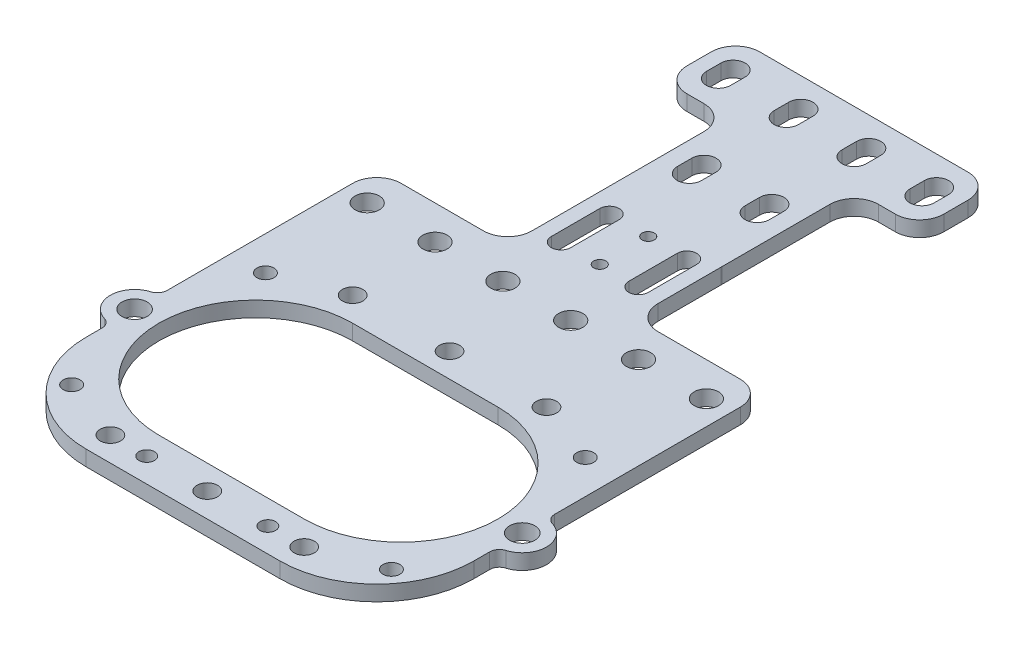
from build123d import *

# Parameters (mm, degrees)
BASE_FLANGE1_DEPTH         = 3.175
CUT_EXTRUDE1_DEPTH         = 3.175
CUT_EXTRUDE2_DEPTH         = 3.175
CUT_EXTRUDE3_DEPTH         = 291.545849439
CUT_EXTRUDE4_DEPTH         = 291.545849439
CUT_EXTRUDE5_DEPTH         = 291.545849439
CUT_EXTRUDE6_DEPTH         = 291.545849439
CUT_EXTRUDE7_DEPTH         = 291.545849439
CUT_EXTRUDE8_DEPTH         = 291.545849439
CUT_EXTRUDE9_DEPTH         = 291.545849439
CUT_EXTRUDE10_DEPTH        = 291.545849439
CUT_EXTRUDE11_DEPTH        = 291.545849439
F_4_2_4_2_DIAMETER_HOLE1_D = 4.2
F_5_2_5_2_DIAMETER_HOLE1_D = 5.2
F_3_5_3_5_DIAMETER_HOLE1_D = 3.5
F_3_2_3_2_DIAMETER_HOLE1_D = 3.2
F_5_0_5_DIAMETER_HOLE1_D   = 5
F_2_5_2_5_DIAMETER_HOLE1_D = 2.5


# Sheet-metal steps are written as plain solids
with BuildPart() as part:
    # Sketch11 → Base-Flange1 (new body)
    with BuildSketch(Plane(origin=(0, 32.675, 0), x_dir=(1, 0, 0), z_dir=(0, 1, 0))):
        with BuildLine():
            Line((222.001, 57.5), (222.001, 22))
            ThreePointArc((222.001, 22), (220.536533906, 18.464466094), (217.001, 17))
            Line((217.001, 17), (200.001, 17))
            ThreePointArc((200.001, 17), (196.465466094, 15.535533906), (195.001, 12))
            Line((195.001, 12), (195.001, -26.291796068))
            ThreePointArc((195.001, -26.291796068), (194.604567451, -27.487024677), (193.572428571, -28.208425763))
            ThreePointArc((193.572428571, -28.208425763), (190.001, -33), (193.572428571, -37.791574237))
            ThreePointArc((193.572428571, -37.791574237), (194.604567451, -38.512975323), (195.001, -39.708203932))
            Line((195.001, -39.708203932), (195.001, -43))
            ThreePointArc((195.001, -43), (200.858864376, -57.142135624), (215.001, -63))
            Line((215.001, -63), (255.001, -63))
            ThreePointArc((255.001, -63), (269.143135624, -57.142135624), (275.001, -43))
            Line((275.001, -43), (275.001, -39.708203932))
            ThreePointArc((275.001, -39.708203932), (275.397432549, -38.512975323), (276.429571429, -37.791574237))
            ThreePointArc((276.429571429, -37.791574237), (280.001, -33), (276.429571429, -28.208425763))
            ThreePointArc((276.429571429, -28.208425763), (275.397432549, -27.487024677), (275.001, -26.291796068))
            Line((275.001, -26.291796068), (275.001, 12))
            ThreePointArc((275.001, 12), (273.536533906, 15.535533906), (270.001, 17))
            Line((270.001, 17), (253.001, 17))
            ThreePointArc((253.001, 17), (249.465466094, 18.464466094), (248.001, 22))
            Line((248.001, 22), (248.001, 57.5))
            ThreePointArc((248.001, 57.5), (249.465466094, 61.035533906), (253.001, 62.5))
            Line((253.001, 62.5), (256.501, 62.5))
            ThreePointArc((256.501, 62.5), (260.036533906, 63.964466094), (261.501, 67.5))
            Line((261.501, 67.5), (261.501, 72.5))
            ThreePointArc((261.501, 72.5), (260.036533906, 76.035533906), (256.501, 77.5))
            Line((256.501, 77.5), (213.501, 77.5))
            ThreePointArc((213.501, 77.5), (209.965466094, 76.035533906), (208.501, 72.5))
            Line((208.501, 72.5), (208.501, 67.5))
            ThreePointArc((208.501, 67.5), (209.965466094, 63.964466094), (213.501, 62.5))
            Line((213.501, 62.5), (217.001, 62.5))
            ThreePointArc((217.001, 62.5), (220.536533906, 61.035533906), (222.001, 57.5))
        make_face()
    extrude(amount=-BASE_FLANGE1_DEPTH)

    # Sketch16 → Cut-Extrude1 (cut)
    with BuildSketch(Plane.XZ.offset(-29.5)):
        with BuildLine():
            Line((222.001, -35), (222.001, -35.230121613))
            Line((222.001, -35.230121613), (222.006298403, -35.230121613))
            ThreePointArc((222.006298403, -35.230121613), (222.002324776, -35.1150913), (222.001, -35))
        make_face()
    extrude(amount=-CUT_EXTRUDE1_DEPTH, mode=Mode.SUBTRACT)

    # Sketch17 → Cut-Extrude2 (cut)
    with BuildSketch(Plane.XZ.offset(-29.5)):
        with BuildLine():
            Line((248.001, -35.230121613), (248.001, -35))
            ThreePointArc((248.001, -35), (247.999675224, -35.1150913), (247.995701597, -35.230121613))
            Line((247.995701597, -35.230121613), (248.001, -35.230121613))
        make_face()
    extrude(amount=-CUT_EXTRUDE2_DEPTH, mode=Mode.SUBTRACT)

    # Sketch18 → Cut-Extrude3 (cut, through all)
    with BuildSketch(Plane(origin=(0, 32.675, 0), x_dir=(-1, 0, 0), z_dir=(0, 1, 0))):
        with BuildLine():
            Line((-250.001, 13), (-220.001, 13))
            ThreePointArc((-220.001, 13), (-200.001, 33), (-220.001, 53))
            Line((-220.001, 53), (-250.001, 53))
            ThreePointArc((-250.001, 53), (-270.001, 33), (-250.001, 13))
        make_face()
    extrude(amount=-CUT_EXTRUDE3_DEPTH, mode=Mode.SUBTRACT)

    # Sketch19 → Cut-Extrude4 (cut, through all)
    with BuildSketch(Plane(origin=(0, 32.675, 0), x_dir=(-1, 0, 0), z_dir=(0, 1, 0))):
        with BuildLine():
            Line((-225.001, -33), (-225.001, -23))
            ThreePointArc((-225.001, -23), (-227.001, -21), (-229.001, -23))
            Line((-229.001, -23), (-229.001, -33))
            ThreePointArc((-229.001, -33), (-227.001, -35), (-225.001, -33))
        make_face()
    extrude(amount=-CUT_EXTRUDE4_DEPTH, mode=Mode.SUBTRACT)

    # Sketch20 → Cut-Extrude5 (cut, through all)
    with BuildSketch(Plane(origin=(0, 32.675, 0), x_dir=(-1, 0, 0), z_dir=(0, 1, 0))):
        with BuildLine():
            Line((-241.001, -33), (-241.001, -23))
            ThreePointArc((-241.001, -23), (-243.001, -21), (-245.001, -23))
            Line((-245.001, -23), (-245.001, -33))
            ThreePointArc((-245.001, -33), (-243.001, -35), (-241.001, -33))
        make_face()
    extrude(amount=-CUT_EXTRUDE5_DEPTH, mode=Mode.SUBTRACT)

    # Sketch21 → Cut-Extrude6 (cut, through all)
    with BuildSketch(Plane(origin=(0, 32.675, 0), x_dir=(-1, 0, 0), z_dir=(0, 1, 0))):
        with BuildLine():
            Line((-225.501, -51.5), (-225.501, -48.5))
            ThreePointArc((-225.501, -48.5), (-228.001, -46), (-230.501, -48.5))
            Line((-230.501, -48.5), (-230.501, -51.5))
            ThreePointArc((-230.501, -51.5), (-228.001, -54), (-225.501, -51.5))
        make_face()
    extrude(amount=-CUT_EXTRUDE6_DEPTH, mode=Mode.SUBTRACT)

    # Sketch22 → Cut-Extrude7 (cut, through all)
    with BuildSketch(Plane(origin=(0, 32.675, 0), x_dir=(-1, 0, 0), z_dir=(0, 1, 0))):
        with BuildLine():
            Line((-239.501, -51.5), (-239.501, -48.5))
            ThreePointArc((-239.501, -48.5), (-242.001, -46), (-244.501, -48.5))
            Line((-244.501, -48.5), (-244.501, -51.5))
            ThreePointArc((-244.501, -51.5), (-242.001, -54), (-239.501, -51.5))
        make_face()
    extrude(amount=-CUT_EXTRUDE7_DEPTH, mode=Mode.SUBTRACT)

    # Sketch23 → Cut-Extrude8 (cut, through all)
    with BuildSketch(Plane(origin=(0, 32.675, 0), x_dir=(-1, 0, 0), z_dir=(0, 1, 0))):
        with BuildLine():
            Line((-211.501, -71.5), (-211.501, -68.5))
            ThreePointArc((-211.501, -68.5), (-214.001, -66), (-216.501, -68.5))
            Line((-216.501, -68.5), (-216.501, -71.5))
            ThreePointArc((-216.501, -71.5), (-214.001, -74), (-211.501, -71.5))
        make_face()
    extrude(amount=-CUT_EXTRUDE8_DEPTH, mode=Mode.SUBTRACT)

    # Sketch24 → Cut-Extrude9 (cut, through all)
    with BuildSketch(Plane(origin=(0, 32.675, 0), x_dir=(-1, 0, 0), z_dir=(0, 1, 0))):
        with BuildLine():
            Line((-225.501, -71.5), (-225.501, -68.5))
            ThreePointArc((-225.501, -68.5), (-228.001, -66), (-230.501, -68.5))
            Line((-230.501, -68.5), (-230.501, -71.5))
            ThreePointArc((-230.501, -71.5), (-228.001, -74), (-225.501, -71.5))
        make_face()
    extrude(amount=-CUT_EXTRUDE9_DEPTH, mode=Mode.SUBTRACT)

    # Sketch25 → Cut-Extrude10 (cut, through all)
    with BuildSketch(Plane(origin=(0, 32.675, 0), x_dir=(-1, 0, 0), z_dir=(0, 1, 0))):
        with BuildLine():
            Line((-239.501, -71.5), (-239.501, -68.5))
            ThreePointArc((-239.501, -68.5), (-242.001, -66), (-244.501, -68.5))
            Line((-244.501, -68.5), (-244.501, -71.5))
            ThreePointArc((-244.501, -71.5), (-242.001, -74), (-239.501, -71.5))
        make_face()
    extrude(amount=-CUT_EXTRUDE10_DEPTH, mode=Mode.SUBTRACT)

    # Sketch26 → Cut-Extrude11 (cut, through all)
    with BuildSketch(Plane.XZ.offset(-29.5)):
        with BuildLine():
            Line((253.501, -68.5), (253.501, -71.5))
            ThreePointArc((253.501, -71.5), (256.001, -74), (258.501, -71.5))
            Line((258.501, -71.5), (258.501, -68.5))
            ThreePointArc((258.501, -68.5), (256.001, -66), (253.501, -68.5))
        make_face()
    extrude(amount=-CUT_EXTRUDE11_DEPTH, mode=Mode.SUBTRACT)

    # Ø4.2 (4.2) Diameter Hole1 (through all)
    with Locations(Plane(origin=(0, 32.675, 0), x_dir=(1, 0, 0), z_dir=(0, 1, 0))):
        with Locations((215.001, -8), (215.001, -58), (255.001, -8), (235.001, -58), (255.001, -58), (235.001, -8)):
            Hole(F_4_2_4_2_DIAMETER_HOLE1_D / 2)

    # Ø5.2 (5.2) Diameter Hole1 (through all)
    with Locations(Plane(origin=(0, 32.675, 0), x_dir=(1, 0, 0), z_dir=(0, 1, 0))):
        with Locations((275.001, -33), (195.001, -33)):
            Hole(F_5_2_5_2_DIAMETER_HOLE1_D / 2)

    # Ø3.5 (3.5) Diameter Hole1 (through all)
    with Locations(Plane(origin=(0, 32.675, 0), x_dir=(1, 0, 0), z_dir=(0, 1, 0))):
        with Locations((202.001, -53), (268.001, -13), (202.001, -13), (268.001, -53)):
            Hole(F_3_5_3_5_DIAMETER_HOLE1_D / 2)

    # Ø3.2 (3.2) Diameter Hole1 (through all)
    with Locations(Plane(origin=(0, 32.675, 0), x_dir=(1, 0, 0), z_dir=(0, 1, 0))):
        with Locations((247.501, -58), (222.501, -58)):
            Hole(F_3_2_3_2_DIAMETER_HOLE1_D / 2)

    # Ø5.0 (5) Diameter Hole1 (through all)
    with Locations(Plane(origin=(0, 32.675, 0), x_dir=(1, 0, 0), z_dir=(0, 1, 0))):
        with Locations((242.001, 10), (228.001, 10), (270.001, 10), (256.001, 10), (214.001, 10), (200.001, 10)):
            Hole(F_5_0_5_DIAMETER_HOLE1_D / 2)

    # Ø2.5 (2.5) Diameter Hole1 (through all)
    with Locations(Plane(origin=(0, 32.675, 0), x_dir=(1, 0, 0), z_dir=(0, 1, 0))):
        with Locations((235.001, 23), (235.001, 33)):
            Hole(F_2_5_2_5_DIAMETER_HOLE1_D / 2)


solid = part.part
